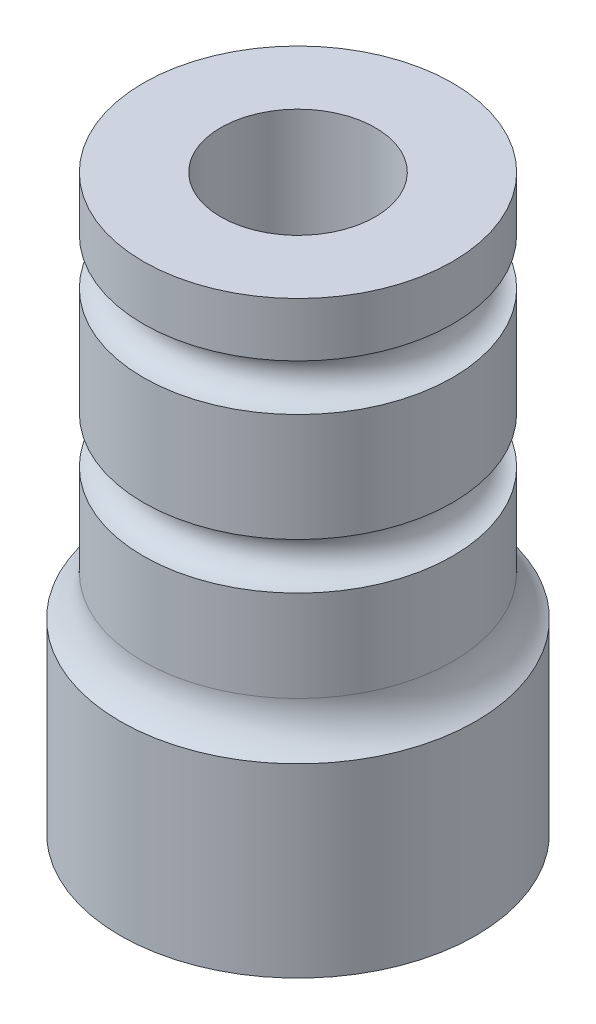
from build123d import *

# Parameters (mm, degrees)
SKETCH_1_R          = 11.5
SKETCH_1_R_2        = 8
EXTRUDE_1_DEPTH     = 8
SKETCH_2_R          = 11.5
EXTRUDE_2_DEPTH     = 4
SKETCH_3_R          = 1.5
CUT_EXTRUDE_1_DEPTH = 2.2
SKETCH_4_R          = 10
SKETCH_4_R_2        = 5
EXTRUDE_3_DEPTH     = 25
FILLET_1_R          = 3
SKETCH_5_R          = 1.5


with BuildPart() as part:
    # Эскиз1 → Вытянуть1 (new body)
    with BuildSketch(Plane(origin=(0, 0, 0), x_dir=(1, 0, 0), z_dir=(0, 1, 0))):
        with Locations(Location((0, 0, 0), (0, 0, 270))):
            Circle(SKETCH_1_R)
        with Locations(Location((0, 0, 0), (0, 0, 270))):
            Circle(SKETCH_1_R_2, mode=Mode.SUBTRACT)
    extrude(amount=EXTRUDE_1_DEPTH)

    # Эскиз2 → Вытянуть2 (add)
    with BuildSketch(Plane(origin=(0, 8, 0), x_dir=(1, 0, 0), z_dir=(0, 1, 0))):
        with Locations(Location((0, 0, 0), (0, 0, 270))):
            Circle(SKETCH_2_R)
    extrude(amount=EXTRUDE_2_DEPTH)

    # Эскиз3 → Вырез-Вытянуть1 (cut)
    with BuildSketch(Plane(origin=(0, 7.979736606, 0), x_dir=(1, 0, 0), z_dir=(0, 1, 0))):
        with Locations(Location((-1.488385607, -5.972232604, 0), (0, 0, 270))):
            Circle(SKETCH_3_R)
        with Locations(Location((1.488385607, 5.972232604, 0), (0, 0, 270))):
            Circle(SKETCH_3_R)
    extrude(amount=CUT_EXTRUDE_1_DEPTH, mode=Mode.SUBTRACT)

    # Эскиз4 → Вытянуть3 (add)
    with BuildSketch(Plane(origin=(0, 12, 0), x_dir=(1, 0, 0), z_dir=(0, 1, 0))):
        with Locations(Location((0, 0, 0), (0, 0, 270))):
            Circle(SKETCH_4_R)
        with Locations(Location((0, 0, 0), (0, 0, 270))):
            Circle(SKETCH_4_R_2, mode=Mode.SUBTRACT)
    extrude(amount=EXTRUDE_3_DEPTH)

    # Скругление1
    # the kernel refuses this fillet: 3 mm, written as the material it adds along each edge
    with BuildSketch(Plane(origin=(0, 12, 0), x_dir=(0, 0, 1), z_dir=(-1, 0, 0))) as fillet_1_piece_1:
        with BuildLine():
            CenterArc((13, 2.598076211), FILLET_1_R, 180, 60)
            Line((10, 2.598076211), (9.94, 2.598076211))
            Line((9.94, 2.598076211), (9.94, 0))
            Line((9.94, 0), (10, -0.06))
            ThreePointArc((10, -0.06), (10.75, -0.06), (11.47, -0.051961524))
            Line((11.47, -0.051961524), (11.5, 0))
        make_face()
    revolve(axis=Axis((0, 12, 0), (0, 1, 0)))

    # Вырез-По траектории2: sweep along a path in Эскиз7
    with BuildLine(Plane(origin=(0, 32, 0), x_dir=(-1, 0, 0), z_dir=(0, 1, 0))) as sweep_2_path:
        CenterArc((0, 0), 10, 0, 360)
    # Эскиз5 → Вырез-По траектории2 (sweep, cut)
    with BuildSketch(Plane(origin=(0, 0, 0), x_dir=(0, 0, -1), z_dir=(1, 0, 0))):
        with Locations((-9.994082338, 22)):
            Circle(SKETCH_5_R)
        with Locations((-10, 32)):
            Circle(SKETCH_5_R)
    sweep(path=sweep_2_path.line, mode=Mode.SUBTRACT)


solid = part.part
